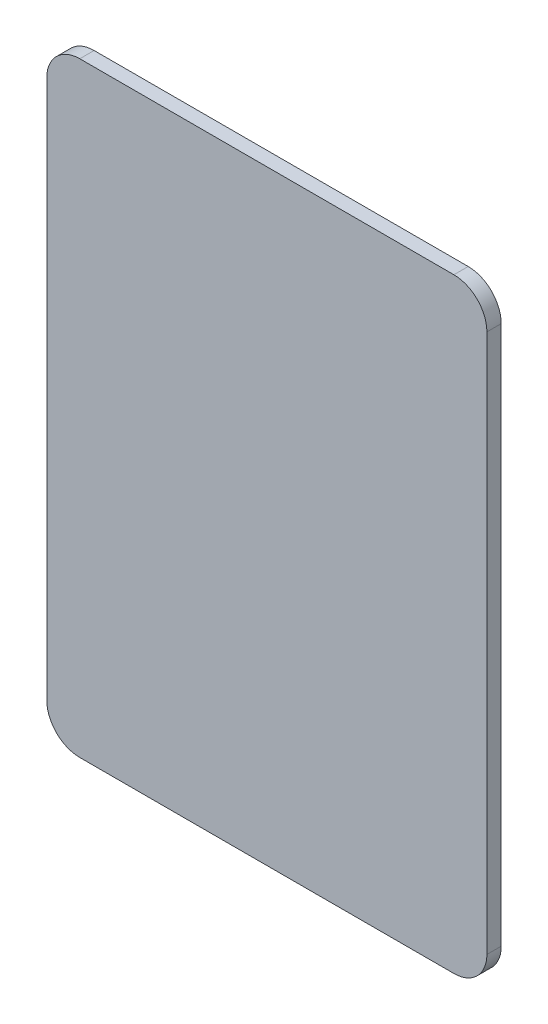
from build123d import *

# Parameters (mm, degrees)
SKETCH1_W           = 55
SKETCH1_H           = 40
BOSS_EXTRUDE1_DEPTH = 1.3
FILLET1_R           = 3


with BuildPart() as part:
    # Sketch1 → Boss-Extrude1 (new body)
    with BuildSketch(Plane(origin=(0, 0, 0), x_dir=(0, 1, 0), z_dir=(0, 0, 1))):
        Rectangle(SKETCH1_W, SKETCH1_H)
    extrude(amount=BOSS_EXTRUDE1_DEPTH)

    # Fillet1
    fillet1_edges = [part.edges().sort_by_distance(p)[0] for p in [
        (-20, 27.5, 0.65),
        (-20, -27.5, 0.65),
        (20, 27.5, 0.65),
        (20, -27.5, 0.65),
    ]]
    fillet(fillet1_edges, radius=FILLET1_R)


solid = part.part
